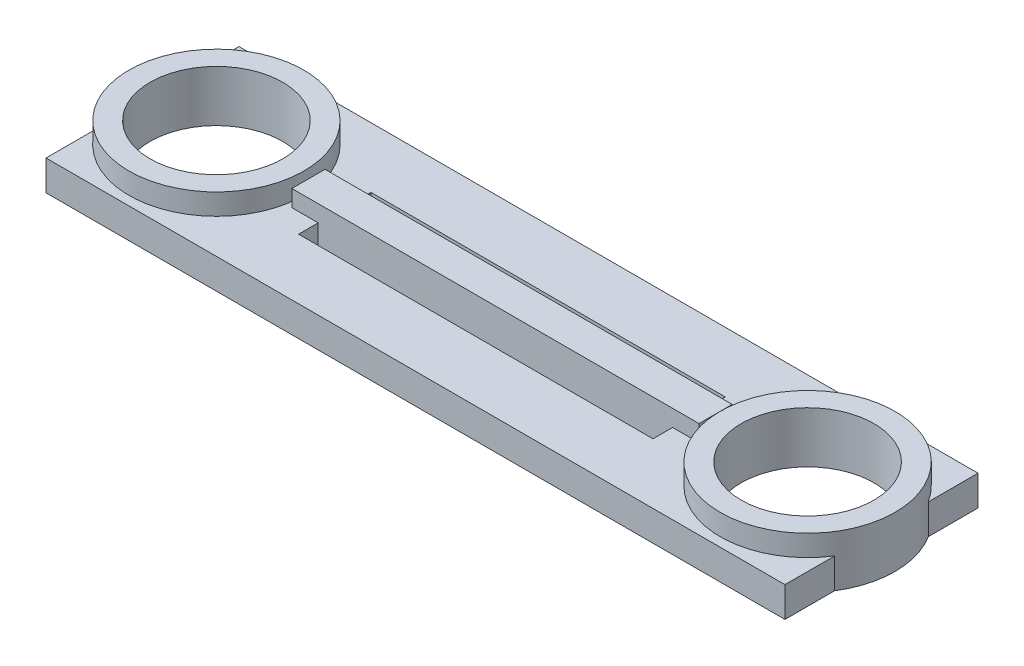
from build123d import *

# Parameters (mm, degrees)
F_01_LINK_PROFILE_W            = 490
F_01_LINK_PROFILE_H            = 128
F_01_LINK_PROFILE_R            = 44
F_01_LINK_PROFILE_W_2          = 235
F_01_LINK_PROFILE_H_2          = 48
F_01_LINK_PLATE_DEPTH          = 20
F_02_END_BOSS_PROFILES_R       = 58
F_02_END_BOSS_PROFILES_R_2     = 44
F_02_BEARING_SEAT_BOSSES_DEPTH = 34
F_03_CENTER_RIB_PROFILE_W      = 270
F_03_CENTER_RIB_PROFILE_H      = 22
F_03_CENTER_RIB_DEPTH          = 31


with BuildPart() as part:
    # 01_Link_Profile → 01_Link_Plate (new body)
    with BuildSketch(Plane(origin=(0, 0, 0), x_dir=(1, 0, 0), z_dir=(0, 1, 0))):
        Rectangle(F_01_LINK_PROFILE_W, F_01_LINK_PROFILE_H)
        with Locations((-196, 0)):
            Circle(F_01_LINK_PROFILE_R, mode=Mode.SUBTRACT)
        with Locations((196, 0)):
            Circle(F_01_LINK_PROFILE_R, mode=Mode.SUBTRACT)
        Rectangle(F_01_LINK_PROFILE_W_2, F_01_LINK_PROFILE_H_2, mode=Mode.SUBTRACT)
    extrude(amount=F_01_LINK_PLATE_DEPTH)

    # 02_End_Boss_Profiles → 02_Bearing_Seat_Bosses (add)
    # profile 1 of 2: a face of its own
    with BuildSketch(Plane(origin=(0, 0, 0), x_dir=(1, 0, 0), z_dir=(0, 1, 0))):
        with Locations((-196, 0)):
            Circle(F_02_END_BOSS_PROFILES_R)
        with Locations((-196, 0)):
            Circle(F_02_END_BOSS_PROFILES_R_2, mode=Mode.SUBTRACT)
    # profile 2 of 2: a face of its own
    with BuildSketch(Plane(origin=(0, 0, 0), x_dir=(1, 0, 0), z_dir=(0, 1, 0))):
        with Locations((196, 0)):
            Circle(F_02_END_BOSS_PROFILES_R)
        with Locations((196, 0)):
            Circle(F_02_END_BOSS_PROFILES_R_2, mode=Mode.SUBTRACT)
    extrude(amount=F_02_BEARING_SEAT_BOSSES_DEPTH)

    # 03_Center_Rib_Profile → 03_Center_Rib (add)
    with BuildSketch(Plane(origin=(0, 0, 0), x_dir=(1, 0, 0), z_dir=(0, 1, 0))):
        Rectangle(F_03_CENTER_RIB_PROFILE_W, F_03_CENTER_RIB_PROFILE_H)
    extrude(amount=F_03_CENTER_RIB_DEPTH)


solid = part.part
